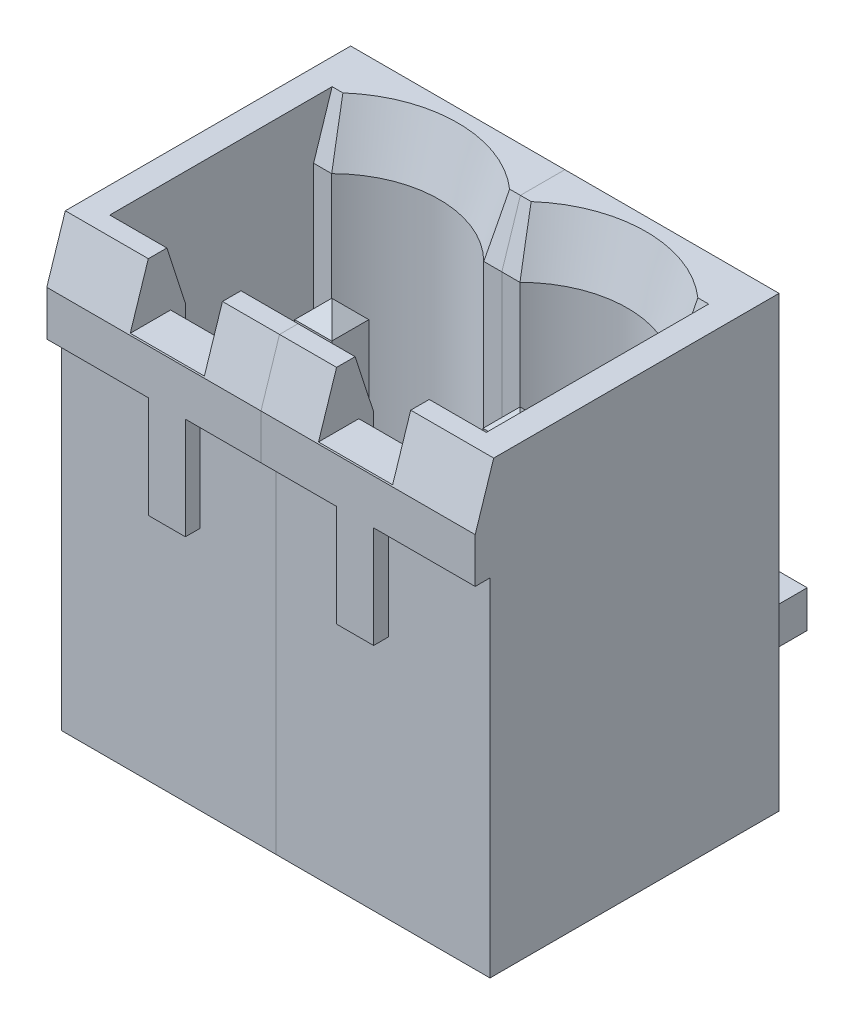
from build123d import *
from OCP.BRepFilletAPI import BRepFilletAPI_MakeChamfer

# Parameters (mm, degrees)
SKETCH_1_W             = 5.08
SKETCH_1_H             = 12.1
EXTRUDE_1_DEPTH        = 8.2
CUT_EXTRUDE_1_DEPTH    = 8.7
SKETCH_3_R             = 1.2
EXTRUDE_2_DEPTH        = 2
FILLET_1_R             = 0.25
CHAMFER_1_SIZE         = 0.5
CHAMFER_1_SIZE2        = 1.538841769
SKETCH_4_W             = 2
SKETCH_4_H             = 1.010953213
CUT_EXTRUDE_2_DEPTH    = 4.75
SKETCH_5_W             = 2
SKETCH_5_H             = 1.705458635
CUT_EXTRUDE_3_DEPTH    = 1.5
CHAMFER_2_SIZE         = 0.5
CHAMFER_2_SIZE2        = 1.538841769
SKETCH_6_W             = 5.08
SKETCH_6_H             = 6.6
CUT_EXTRUDE_4_DEPTH    = 0.4
SKETCH_7_W             = 2.04
SKETCH_7_H             = 2.75
CUT_EXTRUDE_5_DEPTH    = 0.4
EXTRUDE_1_2_DEPTH      = 0.5
EXTRUDE_1_2_DEPTH_BACK = 0.5
CHAMFER_3_SIZE         = 0.5
SKETCH_9_W             = 1
SKETCH_9_H             = 2.1
SKETCH_9_W_2           = 1.04
CUT_EXTRUDE_6_DEPTH    = 6
PATTERN_LINEAR_1_COUNT = 2
PATTERN_LINEAR_1_PITCH = 5.08
EXTRUDE_3_DEPTH        = 0.7
EXTRUDE_4_DEPTH        = 0.7
MOVE_BODY_1_ANGLE      = 180


with BuildPart() as part:
    # Эскиз1 → Extrude 1 (new body)
    with BuildSketch(Plane(origin=(0, 0, 0), x_dir=(1, 0, 0), z_dir=(0, 1, 0))):
        Rectangle(SKETCH_1_W, SKETCH_1_H)
    extrude(amount=EXTRUDE_1_DEPTH)

    # Эскиз2 → Вырез-Вытянуть1 (cut)
    with BuildSketch(Plane.XY.offset(6.05)):
        with BuildLine():
            Line((-2.54, 6.7), (2.54, 6.7))
            Line((2.54, 6.7), (2.54, 1.7))
            Line((2.54, 1.7), (2.05121915, 1.7))
            ThreePointArc((2.05121915, 1.7), (0, 0.85), (-2.05121915, 1.7))
            Line((-2.05121915, 1.7), (-2.54, 1.7))
            Line((-2.54, 1.7), (-2.54, 6.7))
        make_face()
    extrude(amount=-CUT_EXTRUDE_1_DEPTH, mode=Mode.SUBTRACT)

    # Эскиз3 → Бобышка-Вытянуть2 (add)
    with BuildSketch(Plane.XY.offset(-2.65)):
        with Locations((0, 3.75)):
            Circle(SKETCH_3_R)
    extrude(amount=EXTRUDE_2_DEPTH)

    # Скругление1
    fillet_1_edges = [part.edges().sort_by_distance(p)[0] for p in [
        (-1.2, 3.75, -0.65),
    ]]
    fillet(fillet_1_edges, radius=FILLET_1_R)

    # Фаска1: one chamfer whose edges measure the first distance from different faces: ONE call of the kernel's chamfer builder (chamfer() names one face for all edges)
    chamfer_1_edges_1 = [part.edges().sort_by_distance(p)[0] for p in [
        (0, 6.7, 6.05),
    ]]
    chamfer_1_side_1 = [part.faces().sort_by_distance(p)[0] for p in [
        (0, 7.45, 6.05),
    ]]
    chamfer_1_edges_2 = [part.edges().sort_by_distance(p)[0] for p in [
        (2.295609575, 1.7, 6.05),
        (-2.295609575, 1.7, 6.05),
        (0, 0.85, 6.05),
    ]]
    chamfer_1_side_2 = [part.faces().sort_by_distance(p)[0] for p in [
        (0, 0.655214235, 6.05),
    ]]
    chamfer_1 = BRepFilletAPI_MakeChamfer(part.part.solid().wrapped)
    for e in chamfer_1_edges_1:
        chamfer_1.Add(CHAMFER_1_SIZE, CHAMFER_1_SIZE2, e.wrapped, chamfer_1_side_1[0].wrapped)  # the first distance lies on this face
    for e in chamfer_1_edges_2:
        chamfer_1.Add(CHAMFER_1_SIZE, CHAMFER_1_SIZE2, e.wrapped, chamfer_1_side_2[0].wrapped)  # the first distance lies on this face
    add(Compound.cast(chamfer_1.Shape()), mode=Mode.REPLACE)

    # Эскиз4 → Вырез-Вытянуть2 (cut)
    with BuildSketch(Plane.XY.offset(6.05)):
        with Locations((0, 6.594523394)):
            Rectangle(SKETCH_4_W, SKETCH_4_H)
    extrude(amount=-CUT_EXTRUDE_2_DEPTH, mode=Mode.SUBTRACT)

    # Эскиз5 → Вырез-Вытянуть3 (cut)
    with BuildSketch(Plane.XY.offset(6.05)):
        with Locations((0, 7.552729318)):
            Rectangle(SKETCH_5_W, SKETCH_5_H)
    extrude(amount=-CUT_EXTRUDE_3_DEPTH, mode=Mode.SUBTRACT)

    # Фаска2
    chamfer_2_edges = [part.edges().sort_by_distance(p)[0] for p in [
        (-1.77, 8.2, 6.05),
    ]]
    chamfer_2_side = [part.faces().sort_by_distance(p)[0] for p in [
        (-1.77, 7.7, 6.05),
    ]]
    chamfer(chamfer_2_edges, length=CHAMFER_2_SIZE, length2=CHAMFER_2_SIZE2, reference=chamfer_2_side[0])

    # Эскиз6 → Вырез-Вытянуть4 (cut)
    with BuildSketch(Plane(origin=(0, 8.2, 0), x_dir=(1, 0, 0), z_dir=(0, 1, 0))):
        with Locations((0, 2.75)):
            Rectangle(SKETCH_6_W, SKETCH_6_H)
    extrude(amount=-CUT_EXTRUDE_4_DEPTH, mode=Mode.SUBTRACT)

    # Эскиз7 → Вырез-Вытянуть5 (cut)
    with BuildSketch(Plane(origin=(0, 8.2, 0), x_dir=(1, 0, 0), z_dir=(0, 1, 0))):
        with Locations((1.52, -1.925)):
            Rectangle(SKETCH_7_W, SKETCH_7_H)
        with Locations((-1.52, -1.925)):
            Rectangle(SKETCH_7_W, SKETCH_7_H)
    extrude(amount=-CUT_EXTRUDE_5_DEPTH, mode=Mode.SUBTRACT)

    # Эскиз9 → Вырез-Вытянуть6 (cut)
    with BuildSketch(Plane.XZ):
        with Locations((0, -5)):
            Rectangle(SKETCH_9_W, SKETCH_9_H)
        with Locations((-2.02, -5)):
            Rectangle(SKETCH_9_W_2, SKETCH_9_H)
        with Locations((2.02, -5)):
            Rectangle(SKETCH_9_W_2, SKETCH_9_H)
    extrude(amount=-CUT_EXTRUDE_6_DEPTH, mode=Mode.SUBTRACT)


with BuildPart() as body_2:
    # Эскиз8 → Extrude 1 2 (new, two sides: drawn at the far end of the back side and taken through both)
    with BuildSketch(Plane(origin=(0, 0, 0), x_dir=(0, 0, -1), z_dir=(1, 0, 0)).offset(-EXTRUDE_1_2_DEPTH_BACK)):
        with BuildLine():
            Line((-3.65, 3.25), (3.95, 3.25))
            Line((3.95, 3.25), (3.95, -4))
            Line((3.95, -4), (4.95, -4))
            Line((4.95, -4), (4.95, 3.25))
            ThreePointArc((4.95, 3.25), (4.657106781, 3.957106781), (3.95, 4.25))
            Line((3.95, 4.25), (-3.65, 4.25))
            Line((-3.65, 4.25), (-3.65, 3.25))
        make_face()
    extrude(amount=EXTRUDE_1_2_DEPTH + EXTRUDE_1_2_DEPTH_BACK)

    # Фаска3
    chamfer_3_edges = [body_2.edges().sort_by_distance(p)[0] for p in [
        (0, 3.25, 3.65),
        (0, 4.25, 3.65),
        (0, -4, -4.95),
        (0, -4, -3.95),
        (0.5, -4, -4.45),
        (0.5, 3.75, 3.65),
        (-0.5, 3.75, 3.65),
        (-0.5, -4, -4.45),
    ]]
    chamfer(chamfer_3_edges, length=CHAMFER_3_SIZE - 0.0001)  # a hair under: the kernel refuses the full size


with BuildPart() as pattern_linear_1_1:
    # Линейный массив1: pattern copy
    add(body_2.part.moved(Location(Vector(-1, 0, 0) * (1 * PATTERN_LINEAR_1_PITCH))))


with BuildPart() as pattern_linear_1_2:
    # Линейный массив1: pattern copy
    add(part.part.moved(Location(Vector(-1, 0, 0) * (1 * PATTERN_LINEAR_1_PITCH))))

    # Эскиз11 → Бобышка-Вытянуть4 (add)
    with BuildSketch(Plane.ZY.offset(7.62)):
        Polygon((-6.05, 7.8), (-6.05, 0), (6.05, 0), (6.05, 7.7), (4.511158231, 8.2), (3.3, 8.2), (3.3, 7.8), align=None)
    extrude(amount=EXTRUDE_4_DEPTH)


with BuildPart() as part_1:
    add(part.part)

    # Эскиз10 → Бобышка-Вытянуть3 (add)
    with BuildSketch(Plane(origin=(2.54, 0, 0), x_dir=(0, 0, -1), z_dir=(1, 0, 0))):
        Polygon((6.05, 7.8), (-3.3, 7.8), (-3.3, 8.2), (-4.511158231, 8.2), (-6.05, 7.7), (-6.05, 0), (6.05, 0), align=None)
    extrude(amount=EXTRUDE_3_DEPTH)


with BuildPart() as body_2_1:
    # Move Body 1: moved
    add(body_2.part.rotate(Axis((0, 0, 0), (0, 0.7071067811865488, 0.7071067811865462)), MOVE_BODY_1_ANGLE))


with BuildPart() as pattern_linear_1_1_1:
    # Move Body 1: moved
    add(pattern_linear_1_1.part.rotate(Axis((0, 0, 0), (0, 0.7071067811865488, 0.7071067811865462)), MOVE_BODY_1_ANGLE))


with BuildPart() as part_2:
    # Move Body 1: moved
    add(part_1.part.rotate(Axis((0, 0, 0), (0, 0.7071067811865488, 0.7071067811865462)), MOVE_BODY_1_ANGLE))


with BuildPart() as pattern_linear_1_2_1:
    # Move Body 1: moved
    add(pattern_linear_1_2.part.rotate(Axis((0, 0, 0), (0, 0.7071067811865488, 0.7071067811865462)), MOVE_BODY_1_ANGLE))


with BuildPart() as pattern_linear_1_2_2:
    # Move Body 2: read off the stored shape, not the designer's step
    # Move Body 2: moved
    add(pattern_linear_1_2_1.part.moved(Location((0, 4.45, 0))))


with BuildPart() as part_3:
    # Move Body 2 2: moved
    add(part_2.part.moved(Location((0, 4.45, 0))))


with BuildPart() as pattern_linear_1_1_2:
    # Move Body 2 3: moved
    add(pattern_linear_1_1_1.part.moved(Location((0, 4.45, 0))))


with BuildPart() as body_2_2:
    # Move Body 2 4: moved
    add(body_2_1.part.moved(Location((0, 4.45, 0))))


solid = Compound([pattern_linear_1_2_2.part, part_3.part, pattern_linear_1_1_2.part, body_2_2.part])
